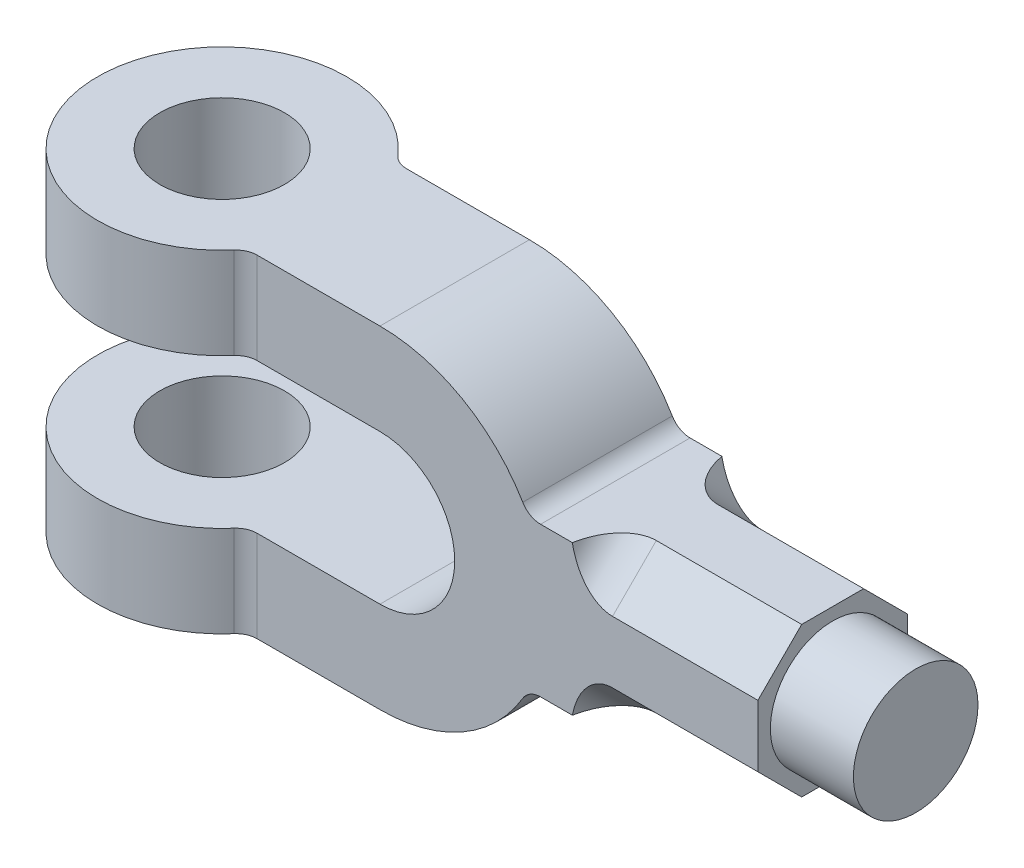
from build123d import *

# Parameters (mm, degrees)
CROQUIS2_R              = 15
SALIENTE_EXTRUIR1_DEPTH = 40
CROQUIS3_W              = 99.474281043
CROQUIS3_H              = 36
CORTAR_EXTRUIR1_DEPTH   = 40
SALIENTE_EXTRUIR2_DEPTH = 36
SALIENTE_EXTRUIR3_DEPTH = 45
CROQUIS8_R              = 15
SALIENTE_EXTRUIR4_DEPTH = 20
REDONDEO1_R             = 10
REDONDEO2_R             = 5
REDONDEO3_R             = 5


with BuildPart() as part:
    # Croquis2 → Saliente-Extruir1 (new, symmetric)
    with BuildSketch(Plane(origin=(0, 0, 0), x_dir=(1, 0, 0), z_dir=(0, 1, 0))):
        with BuildLine():
            Line((24, -18), (56, -18))
            Line((56, -18), (56, 18))
            Line((56, 18), (24, 18))
            ThreePointArc((24, 18), (-30, 0), (24, -18))
        make_face()
        with Locations(Location((0, 0, 0), (0, 0, 270))):
            Circle(CROQUIS2_R, mode=Mode.SUBTRACT)
    extrude(amount=SALIENTE_EXTRUIR1_DEPTH, both=True)

    # Croquis3 → Cortar-Extruir1 (cut, symmetric)
    with BuildSketch(Plane.XY):
        with Locations((15.580182786, 0)):
            Rectangle(CROQUIS3_W, CROQUIS3_H)
    extrude(amount=CORTAR_EXTRUIR1_DEPTH, both=True, mode=Mode.SUBTRACT)


with BuildPart() as cortar_extruir1_piece_1:
    # of the separate pieces the step leaves, piece 1, a body of its own (cortar_extruir1_pieces)
    add(part.part.solids().sort_by_distance((24, -18, 18))[0])



with BuildPart() as cortar_extruir1_piece_2:
    # of the separate pieces the step leaves, piece 2, a body of its own (cortar_extruir1_pieces)
    add(part.part.solids().sort_by_distance((24, 40, 18))[0])


with BuildPart() as cortar_extruir1_piece_1_1:
    add(cortar_extruir1_piece_1.part)

    add(cortar_extruir1_piece_2.part)  # Saliente-Extruir2 merges Cortar-Extruir1 piece 2
    # Croquis5 → Saliente-Extruir2 (add)
    with BuildSketch(Plane.XY.offset(18)):
        with BuildLine():
            Line((91.721142199, 18), (102, 18))
            Line((102, 18), (102, -18))
            Line((102, -18), (91.721142199, -18))
            ThreePointArc((91.721142199, -18), (76.976176963, -34.058772732), (56, -40))
            Line((56, -40), (56, -18))
            ThreePointArc((56, -18), (74, 0), (56, 18))
            Line((56, 18), (56, 40))
            ThreePointArc((56, 40), (76.976176963, 34.058772732), (91.721142199, 18))
        make_face()
    extrude(amount=-SALIENTE_EXTRUIR2_DEPTH)

    # Croquis7 → Saliente-Extruir3 (add)
    with BuildSketch(Plane(origin=(102, 0, 0), x_dir=(0, 0, -1), z_dir=(1, 0, 0))):
        Polygon((-7.455844123, 18), (-18, 7.455844123), (-18, -7.455844123), (-7.455844123, -18), (7.455844123, -18), (18, -7.455844123), (18, 7.455844123), (7.455844123, 18), align=None)
    extrude(amount=SALIENTE_EXTRUIR3_DEPTH)

    # Croquis8 → Saliente-Extruir4 (add)
    with BuildSketch(Plane(origin=(147, 0, 0), x_dir=(0, 0, -1), z_dir=(1, 0, 0))):
        Circle(CROQUIS8_R)
    extrude(amount=SALIENTE_EXTRUIR4_DEPTH)

    # Redondeo1
    # the kernel refuses this fillet: 10 mm, written as the material it adds along each edge
    with BuildSketch(Plane(origin=(102, 35.67766953, -10.221825407), x_dir=(1, 0, 0), z_dir=(0, -0.7071067811865477, 0.7071067811865475))) as redondeo1_piece_1_section:
        with BuildLine():
            CenterArc((REDONDEO1_R, REDONDEO1_R), REDONDEO1_R, 180, 90)
            Line((0, REDONDEO1_R), (0, 0))
            Line((0, 0), (REDONDEO1_R, 0))
        make_face()
    redondeo1_piece_1 = extrude(amount=64.911688245, mode=Mode.PRIVATE)
    redondeo1_piece_1 = split(redondeo1_piece_1, bisect_by=Plane(origin=(104.775136412, 13.729156697, 18), z_dir=(0, 0, -1)), keep=Keep.TOP, mode=Mode.PRIVATE)
    redondeo1_piece_1 = split(redondeo1_piece_1, bisect_by=Plane(origin=(104.775136412, 18, 13.729156697), z_dir=(0, -1, 0)), keep=Keep.TOP, mode=Mode.PRIVATE)
    add(redondeo1_piece_1)
    with BuildSketch(Plane(origin=(102, -10.221825407, -35.67766953), x_dir=(1, 0, 0), z_dir=(0, 0.7071067811865475, 0.7071067811865476))) as redondeo1_piece_2_section:
        with BuildLine():
            CenterArc((REDONDEO1_R, REDONDEO1_R), REDONDEO1_R, 180, 90)
            Line((0, REDONDEO1_R), (0, 0))
            Line((0, 0), (REDONDEO1_R, 0))
        make_face()
    redondeo1_piece_2 = extrude(amount=64.911688245, mode=Mode.PRIVATE)
    redondeo1_piece_2 = split(redondeo1_piece_2, bisect_by=Plane(origin=(104.775136412, 18, -13.729156697), z_dir=(0, -1, 0)), keep=Keep.TOP, mode=Mode.PRIVATE)
    redondeo1_piece_2 = split(redondeo1_piece_2, bisect_by=Plane(origin=(104.775136412, 13.729156697, -18), z_dir=(0, 0, 1)), keep=Keep.TOP, mode=Mode.PRIVATE)
    add(redondeo1_piece_2)
    with BuildSketch(Plane(origin=(102, -35.67766953, 10.221825407), x_dir=(1, 0, 0), z_dir=(0, 0.7071067811865477, -0.7071067811865475))) as redondeo1_piece_3_section:
        with BuildLine():
            CenterArc((REDONDEO1_R, REDONDEO1_R), REDONDEO1_R, 180, 90)
            Line((0, REDONDEO1_R), (0, 0))
            Line((0, 0), (REDONDEO1_R, 0))
        make_face()
    redondeo1_piece_3 = extrude(amount=64.911688245, mode=Mode.PRIVATE)
    redondeo1_piece_3 = split(redondeo1_piece_3, bisect_by=Plane(origin=(104.775136412, -18, -13.729156697), z_dir=(0, 1, 0)), keep=Keep.TOP, mode=Mode.PRIVATE)
    redondeo1_piece_3 = split(redondeo1_piece_3, bisect_by=Plane(origin=(104.775136412, -13.729156697, -18), z_dir=(0, 0, 1)), keep=Keep.TOP, mode=Mode.PRIVATE)
    add(redondeo1_piece_3)
    with BuildSketch(Plane(origin=(102, 10.221825407, 35.67766953), x_dir=(0, -0.7071067811865476, 0.7071067811865476), z_dir=(0, -0.7071067811865476, -0.7071067811865476))) as redondeo1_piece_4_section:
        with BuildLine():
            CenterArc((REDONDEO1_R, -REDONDEO1_R), REDONDEO1_R, 90, 90)
            Line((0, -REDONDEO1_R), (0, 0))
            Line((0, 0), (REDONDEO1_R, 0))
        make_face()
    redondeo1_piece_4 = extrude(amount=64.911688245, mode=Mode.PRIVATE)
    redondeo1_piece_4 = split(redondeo1_piece_4, bisect_by=Plane(origin=(104.775136413, -13.729156697, 18), z_dir=(0, 0, -1)), keep=Keep.TOP, mode=Mode.PRIVATE)
    redondeo1_piece_4 = split(redondeo1_piece_4, bisect_by=Plane(origin=(104.775136413, -18, 13.729156697), z_dir=(0, 1, 0)), keep=Keep.TOP, mode=Mode.PRIVATE)
    add(redondeo1_piece_4)

    # Redondeo2
    redondeo2_edges = [cortar_extruir1_piece_1_1.edges().sort_by_distance(p)[0] for p in [
        (91.721142199, 18, 0),
        (91.721142199, -18, 0),
    ]]
    fillet(redondeo2_edges, radius=REDONDEO2_R)

    # Redondeo3
    redondeo3_edges = [cortar_extruir1_piece_1_1.edges().sort_by_distance(p)[0] for p in [
        (24, -29, 18),
        (24, -29, -18),
        (24, 29, -18),
        (24, 29, 18),
    ]]
    fillet(redondeo3_edges, radius=REDONDEO3_R)


solid = cortar_extruir1_piece_1_1.part
